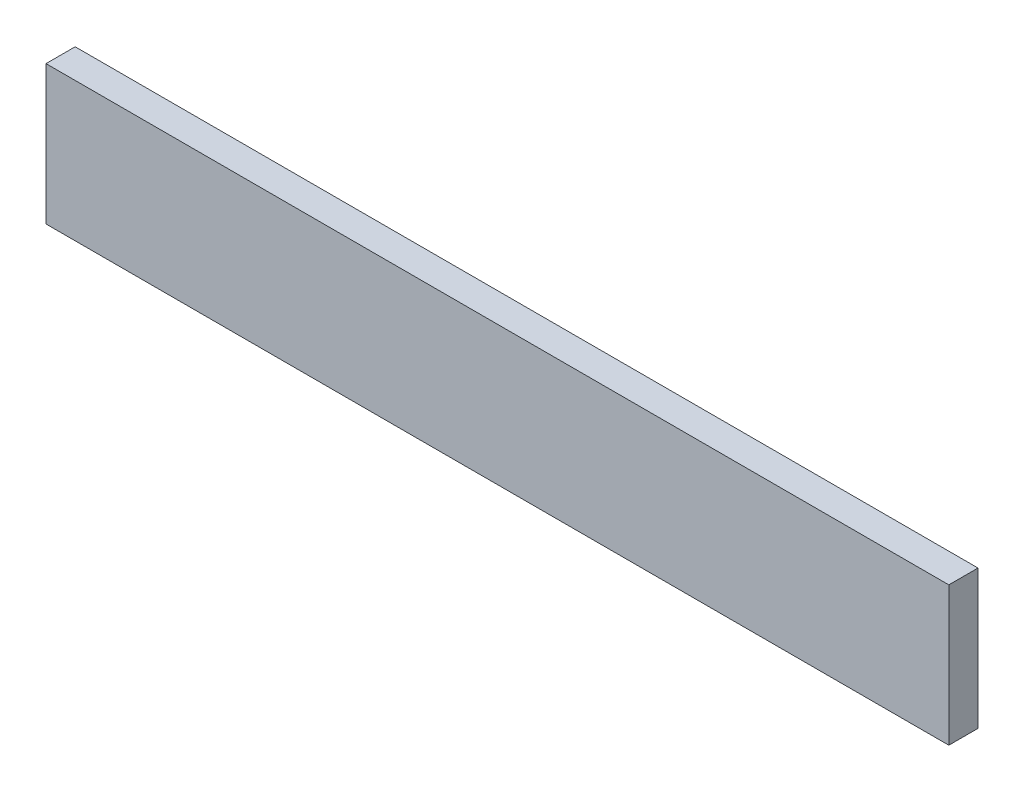
from build123d import *

# Parameters (mm, degrees)
SKETCH1_W           = 165.1
SKETCH1_H           = 25.4
BOSS_EXTRUDE1_DEPTH = 2.667


with BuildPart() as part:
    # Sketch1 → Boss-Extrude1 (new, symmetric)
    with BuildSketch(Plane.XY):
        with Locations((82.55, 12.7)):
            Rectangle(SKETCH1_W, SKETCH1_H)
    extrude(amount=BOSS_EXTRUDE1_DEPTH, both=True)


solid = part.part
